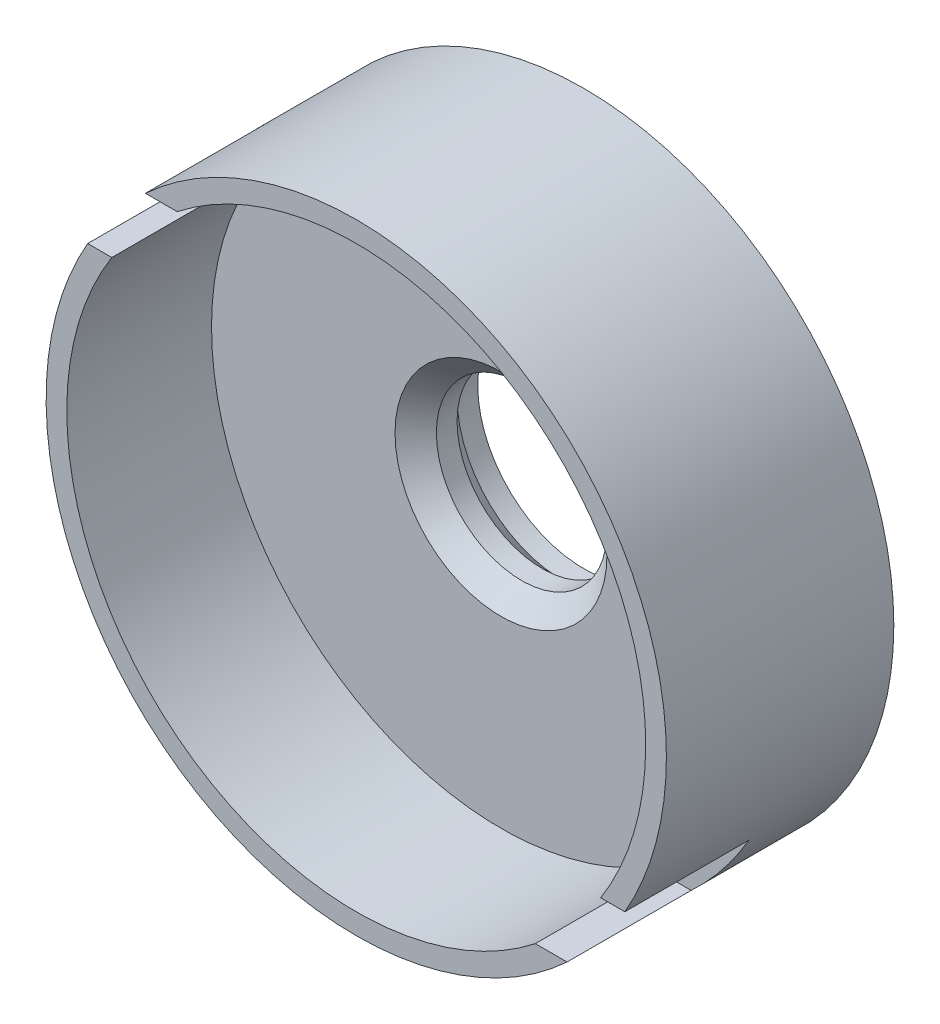
from build123d import *

# Parameters (mm, degrees)
EXTRUDE_1_DEPTH          = 20
EXTRUDE_1_DEPTH_BACK     = 2
SKETCH_5_R               = 30
CUT_EXTRUDE_START        = 6
SKETCH_6_R               = 28
CUT_EXTRUDE_1_DEPTH      = 14
CUT_EXTRUDE_2_DEPTH      = 15
CUT_EXTRUDE_2_DEPTH_BACK = 2
SKETCH_7_R               = 8.25
CUT_EXTRUDE_START_2      = 8
SKETCH_10_W              = 15
SKETCH_10_H              = 7
CUT_EXTRUDE_4_DEPTH      = 12
SKETCH_13_W              = 15
SKETCH_13_H              = 7
CUT_EXTRUDE_5_DEPTH      = 12


with BuildPart() as part:
    # Эскиз5 → Бобышка-Вытянуть1 (new, two sides: drawn at the far end of the back side and taken through both)
    with BuildSketch(Plane.XY.offset(-EXTRUDE_1_DEPTH_BACK)):
        Circle(SKETCH_5_R)
    extrude(amount=EXTRUDE_1_DEPTH + EXTRUDE_1_DEPTH_BACK)

    # Эскиз6 → Вырез-Вытянуть1 (cut)
    with BuildSketch(Plane.XY.offset(CUT_EXTRUDE_START)):
        Circle(SKETCH_6_R)
    extrude(amount=CUT_EXTRUDE_1_DEPTH, mode=Mode.SUBTRACT)

    # Эскиз7 → Вырез-Вытянуть2 (cut, two sides: drawn at the far end of the back side and taken through both)
    with BuildSketch(Plane.XY.offset(-CUT_EXTRUDE_2_DEPTH_BACK)):
        Circle(SKETCH_7_R)
    extrude(amount=CUT_EXTRUDE_2_DEPTH + CUT_EXTRUDE_2_DEPTH_BACK, mode=Mode.SUBTRACT)

    # Эскиз10 → Вырез-Вытянуть4 (cut)
    with BuildSketch(Plane.XY.offset(CUT_EXTRUDE_START_2)):
        with Locations((-22.5, 18.5)):
            Rectangle(SKETCH_10_W, SKETCH_10_H)
    extrude(amount=CUT_EXTRUDE_4_DEPTH, mode=Mode.SUBTRACT)

    # Эскиз13 → Вырез-Вытянуть5 (cut)
    with BuildSketch(Plane.XY.offset(CUT_EXTRUDE_START_2)):
        with Locations((22.5, -18.5)):
            Rectangle(SKETCH_13_W, SKETCH_13_H)
    extrude(amount=CUT_EXTRUDE_5_DEPTH, mode=Mode.SUBTRACT)

    # Эскиз15 → Вырез-Повернуть1 (revolve, cut)
    with BuildSketch(Plane(origin=(0, 0, 0), x_dir=(0, 0, -1), z_dir=(1, 0, 0))):
        Polygon((-6, 8.25), (-4, 8.25), (-6, 10.25), align=None)
        Polygon((2, 8.25), (2, 10.25), (0, 10.25), (-2, 8.25), align=None)
    revolve(axis=Axis((0, 0, 0), (0, 0, 1)), mode=Mode.SUBTRACT)


solid = part.part
